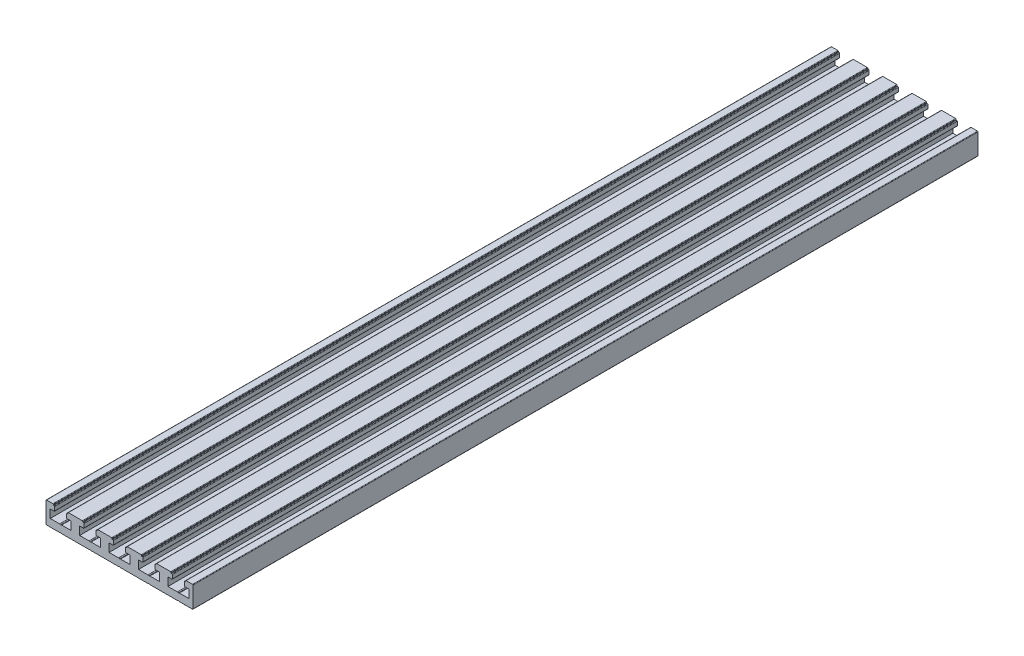
from build123d import *

# Parameters (mm, degrees)
RAWPART_DEPTH                                  = 400
CSK_FOR_M3_FLAT_HEAD_MACHINE_SCREW1_AT_2_COUNT = 2
CSK_FOR_M3_FLAT_HEAD_MACHINE_SCREW1_AT_2_PITCH = 60
CSK_FOR_M3_FLAT_HEAD_MACHINE_SCREW1_AT_3_COUNT = 2
CSK_FOR_M3_FLAT_HEAD_MACHINE_SCREW1_AT_3_PITCH = 271.707515505
CSK_FOR_M3_FLAT_HEAD_MACHINE_SCREW1_AT_4_COUNT = 2
CSK_FOR_M3_FLAT_HEAD_MACHINE_SCREW1_AT_4_PITCH = 264.999950909
M4X0_7_TAPPED_HOLE1_D                          = 3.3


with BuildPart() as part:
    # Sketch1 → RawPart (new body)
    with BuildSketch(Plane(origin=(0, 0, 0), x_dir=(-1, 0, 0), z_dir=(0, 0, -1))):
        with BuildLine():
            Line((-37.45, 8.85), (-37.45, -1.65))
            ThreePointArc((-37.45, -1.65), (-37.376776695, -1.826776695), (-37.2, -1.9))
            Line((-37.2, -1.9), (-30.543629459, -1.9))
            ThreePointArc((-30.543629459, -1.9), (-30.500649598, -1.896277753), (-30.458949592, -1.885221853))
            Line((-30.458949592, -1.885221853), (-30, -1.72))
            Line((-30, -1.72), (-29.541050408, -1.885221853))
            ThreePointArc((-29.541050408, -1.885221853), (-29.499350402, -1.896277753), (-29.456370541, -1.9))
            Line((-29.456370541, -1.9), (-15.543629459, -1.9))
            ThreePointArc((-15.543629459, -1.9), (-15.500649598, -1.896277753), (-15.458949592, -1.885221853))
            Line((-15.458949592, -1.885221853), (-15, -1.72))
            Line((-15, -1.72), (-14.541050408, -1.885221853))
            ThreePointArc((-14.541050408, -1.885221853), (-14.499350402, -1.896277753), (-14.456370541, -1.9))
            Line((-14.456370541, -1.9), (-0.543629459, -1.9))
            ThreePointArc((-0.543629459, -1.9), (-0.500649598, -1.896277753), (-0.458949592, -1.885221853))
            Line((-0.458949592, -1.885221853), (0, -1.72))
            Line((0, -1.72), (0.458949592, -1.885221853))
            ThreePointArc((0.458949592, -1.885221853), (0.500649598, -1.896277753), (0.543629459, -1.9))
            Line((0.543629459, -1.9), (14.456370541, -1.9))
            ThreePointArc((14.456370541, -1.9), (14.499350402, -1.896277753), (14.541050408, -1.885221853))
            Line((14.541050408, -1.885221853), (15, -1.72))
            Line((15, -1.72), (15.458949592, -1.885221853))
            ThreePointArc((15.458949592, -1.885221853), (15.500649598, -1.896277753), (15.543629459, -1.9))
            Line((15.543629459, -1.9), (29.456370541, -1.9))
            ThreePointArc((29.456370541, -1.9), (29.499350402, -1.896277753), (29.541050408, -1.885221853))
            Line((29.541050408, -1.885221853), (30, -1.72))
            Line((30, -1.72), (30.458949592, -1.885221853))
            ThreePointArc((30.458949592, -1.885221853), (30.500649598, -1.896277753), (30.543629459, -1.9))
            Line((30.543629459, -1.9), (37.2, -1.9))
            ThreePointArc((37.2, -1.9), (37.376776695, -1.826776695), (37.45, -1.65))
            Line((37.45, -1.65), (37.45, 8.85))
            ThreePointArc((37.45, 8.85), (37.376776695, 9.026776695), (37.2, 9.1))
            Line((37.2, 9.1), (33.95, 9.1))
            ThreePointArc((33.95, 9.1), (33.773223305, 9.026776695), (33.7, 8.85))
            Line((33.7, 8.85), (33.7, 8.5))
            Line((33.7, 8.5), (33.32, 8.5))
            ThreePointArc((33.32, 8.5), (33.143223305, 8.426776695), (33.07, 8.25))
            Line((33.07, 8.25), (33.07, 6.35))
            ThreePointArc((33.07, 6.35), (33.143223305, 6.173223305), (33.32, 6.1))
            Line((33.32, 6.1), (35.3, 6.1))
            Line((35.3, 6.1), (35.3, 1.9))
            Line((35.3, 1.9), (30.543629459, 1.9))
            ThreePointArc((30.543629459, 1.9), (30.500649598, 1.896277753), (30.458949592, 1.885221853))
            Line((30.458949592, 1.885221853), (30, 1.72))
            Line((30, 1.72), (29.541050408, 1.885221853))
            ThreePointArc((29.541050408, 1.885221853), (29.499350402, 1.896277753), (29.456370541, 1.9))
            Line((29.456370541, 1.9), (24.7, 1.9))
            Line((24.7, 1.9), (24.7, 6.1))
            Line((24.7, 6.1), (26.68, 6.1))
            ThreePointArc((26.68, 6.1), (26.856776695, 6.173223305), (26.93, 6.35))
            Line((26.93, 6.35), (26.93, 8.25))
            ThreePointArc((26.93, 8.25), (26.856776695, 8.426776695), (26.68, 8.5))
            Line((26.68, 8.5), (26.3, 8.5))
            Line((26.3, 8.5), (26.3, 8.85))
            ThreePointArc((26.3, 8.85), (26.226776695, 9.026776695), (26.05, 9.1))
            Line((26.05, 9.1), (18.95, 9.1))
            ThreePointArc((18.95, 9.1), (18.773223305, 9.026776695), (18.7, 8.85))
            Line((18.7, 8.85), (18.7, 8.5))
            Line((18.7, 8.5), (18.32, 8.5))
            ThreePointArc((18.32, 8.5), (18.143223305, 8.426776695), (18.07, 8.25))
            Line((18.07, 8.25), (18.07, 6.35))
            ThreePointArc((18.07, 6.35), (18.143223305, 6.173223305), (18.32, 6.1))
            Line((18.32, 6.1), (20.3, 6.1))
            Line((20.3, 6.1), (20.3, 1.9))
            Line((20.3, 1.9), (15.543629459, 1.9))
            ThreePointArc((15.543629459, 1.9), (15.500649598, 1.896277753), (15.458949592, 1.885221853))
            Line((15.458949592, 1.885221853), (15, 1.72))
            Line((15, 1.72), (14.541050408, 1.885221853))
            ThreePointArc((14.541050408, 1.885221853), (14.499350402, 1.896277753), (14.456370541, 1.9))
            Line((14.456370541, 1.9), (9.7, 1.9))
            Line((9.7, 1.9), (9.7, 6.1))
            Line((9.7, 6.1), (11.68, 6.1))
            ThreePointArc((11.68, 6.1), (11.856776695, 6.173223305), (11.93, 6.35))
            Line((11.93, 6.35), (11.93, 8.25))
            ThreePointArc((11.93, 8.25), (11.856776695, 8.426776695), (11.68, 8.5))
            Line((11.68, 8.5), (11.3, 8.5))
            Line((11.3, 8.5), (11.3, 8.85))
            ThreePointArc((11.3, 8.85), (11.226776695, 9.026776695), (11.05, 9.1))
            Line((11.05, 9.1), (3.95, 9.1))
            ThreePointArc((3.95, 9.1), (3.773223305, 9.026776695), (3.7, 8.85))
            Line((3.7, 8.85), (3.7, 8.5))
            Line((3.7, 8.5), (3.32, 8.5))
            ThreePointArc((3.32, 8.5), (3.143223305, 8.426776695), (3.07, 8.25))
            Line((3.07, 8.25), (3.07, 6.35))
            ThreePointArc((3.07, 6.35), (3.143223305, 6.173223305), (3.32, 6.1))
            Line((3.32, 6.1), (5.3, 6.1))
            Line((5.3, 6.1), (5.3, 1.9))
            Line((5.3, 1.9), (0.543629459, 1.9))
            ThreePointArc((0.543629459, 1.9), (0.500649598, 1.896277753), (0.458949592, 1.885221853))
            Line((0.458949592, 1.885221853), (0, 1.72))
            Line((0, 1.72), (-0.458949592, 1.885221853))
            ThreePointArc((-0.458949592, 1.885221853), (-0.500649598, 1.896277753), (-0.543629459, 1.9))
            Line((-0.543629459, 1.9), (-5.3, 1.9))
            Line((-5.3, 1.9), (-5.3, 6.1))
            Line((-5.3, 6.1), (-3.32, 6.1))
            ThreePointArc((-3.32, 6.1), (-3.143223305, 6.173223305), (-3.07, 6.35))
            Line((-3.07, 6.35), (-3.07, 8.25))
            ThreePointArc((-3.07, 8.25), (-3.143223305, 8.426776695), (-3.32, 8.5))
            Line((-3.32, 8.5), (-3.7, 8.5))
            Line((-3.7, 8.5), (-3.7, 8.85))
            ThreePointArc((-3.7, 8.85), (-3.773223305, 9.026776695), (-3.95, 9.1))
            Line((-3.95, 9.1), (-11.05, 9.1))
            ThreePointArc((-11.05, 9.1), (-11.226776695, 9.026776695), (-11.3, 8.85))
            Line((-11.3, 8.85), (-11.3, 8.5))
            Line((-11.3, 8.5), (-11.68, 8.5))
            ThreePointArc((-11.68, 8.5), (-11.856776695, 8.426776695), (-11.93, 8.25))
            Line((-11.93, 8.25), (-11.93, 6.35))
            ThreePointArc((-11.93, 6.35), (-11.856776695, 6.173223305), (-11.68, 6.1))
            Line((-11.68, 6.1), (-9.7, 6.1))
            Line((-9.7, 6.1), (-9.7, 1.9))
            Line((-9.7, 1.9), (-14.456370541, 1.9))
            ThreePointArc((-14.456370541, 1.9), (-14.499350402, 1.896277753), (-14.541050408, 1.885221853))
            Line((-14.541050408, 1.885221853), (-15, 1.72))
            Line((-15, 1.72), (-15.458949592, 1.885221853))
            ThreePointArc((-15.458949592, 1.885221853), (-15.500649598, 1.896277753), (-15.543629459, 1.9))
            Line((-15.543629459, 1.9), (-20.3, 1.9))
            Line((-20.3, 1.9), (-20.3, 6.1))
            Line((-20.3, 6.1), (-18.32, 6.1))
            ThreePointArc((-18.32, 6.1), (-18.143223305, 6.173223305), (-18.07, 6.35))
            Line((-18.07, 6.35), (-18.07, 8.25))
            ThreePointArc((-18.07, 8.25), (-18.143223305, 8.426776695), (-18.32, 8.5))
            Line((-18.32, 8.5), (-18.7, 8.5))
            Line((-18.7, 8.5), (-18.7, 8.85))
            ThreePointArc((-18.7, 8.85), (-18.773223305, 9.026776695), (-18.95, 9.1))
            Line((-18.95, 9.1), (-26.05, 9.1))
            ThreePointArc((-26.05, 9.1), (-26.226776695, 9.026776695), (-26.3, 8.85))
            Line((-26.3, 8.85), (-26.3, 8.5))
            Line((-26.3, 8.5), (-26.68, 8.5))
            ThreePointArc((-26.68, 8.5), (-26.856776695, 8.426776695), (-26.93, 8.25))
            Line((-26.93, 8.25), (-26.93, 6.35))
            ThreePointArc((-26.93, 6.35), (-26.856776695, 6.173223305), (-26.68, 6.1))
            Line((-26.68, 6.1), (-24.7, 6.1))
            Line((-24.7, 6.1), (-24.7, 1.9))
            Line((-24.7, 1.9), (-29.456370541, 1.9))
            ThreePointArc((-29.456370541, 1.9), (-29.499350402, 1.896277753), (-29.541050408, 1.885221853))
            Line((-29.541050408, 1.885221853), (-30, 1.72))
            Line((-30, 1.72), (-30.458949592, 1.885221853))
            ThreePointArc((-30.458949592, 1.885221853), (-30.500649598, 1.896277753), (-30.543629459, 1.9))
            Line((-30.543629459, 1.9), (-35.3, 1.9))
            Line((-35.3, 1.9), (-35.3, 6.1))
            Line((-35.3, 6.1), (-33.32, 6.1))
            ThreePointArc((-33.32, 6.1), (-33.143223305, 6.173223305), (-33.07, 6.35))
            Line((-33.07, 6.35), (-33.07, 8.25))
            ThreePointArc((-33.07, 8.25), (-33.143223305, 8.426776695), (-33.32, 8.5))
            Line((-33.32, 8.5), (-33.7, 8.5))
            Line((-33.7, 8.5), (-33.7, 8.85))
            ThreePointArc((-33.7, 8.85), (-33.773223305, 9.026776695), (-33.95, 9.1))
            Line((-33.95, 9.1), (-37.2, 9.1))
            ThreePointArc((-37.2, 9.1), (-37.376776695, 9.026776695), (-37.45, 8.85))
        make_face()
    extrude(amount=-RAWPART_DEPTH)

    # Sketch2 → CSK for M3 Flat Head Machine Screw1 (revolve, cut)
    with BuildSketch(Plane(origin=(-30, 1.9, 65), x_dir=(0, 0, 1), z_dir=(1, 0, 0))):
        Polygon((0, 0), (0, 3.8), (1.6, 3.8), (1.6, 1.9), (3, 0.5), (3, 0), align=None)
    csk_for_m3_flat_head_machine_screw1 = revolve(axis=Axis((-30, 8.25, 65), (0, -1, 0)), mode=Mode.SUBTRACT)

    # CSK for M3 Flat Head Machine Screw1 at 2: CSK for M3 Flat Head Machine Screw1 ×2
    with Locations(*[(i * CSK_FOR_M3_FLAT_HEAD_MACHINE_SCREW1_AT_2_PITCH, 0, 0) for i in range(1, CSK_FOR_M3_FLAT_HEAD_MACHINE_SCREW1_AT_2_COUNT)]):
        add(csk_for_m3_flat_head_machine_screw1, mode=Mode.SUBTRACT)

    # CSK for M3 Flat Head Machine Screw1 at 3: CSK for M3 Flat Head Machine Screw1 ×2
    with Locations(*[Vector(0.22082569151065257, 0, 0.9753132901631364) * (i * CSK_FOR_M3_FLAT_HEAD_MACHINE_SCREW1_AT_3_PITCH) for i in range(1, CSK_FOR_M3_FLAT_HEAD_MACHINE_SCREW1_AT_3_COUNT)]):
        add(csk_for_m3_flat_head_machine_screw1, mode=Mode.SUBTRACT)

    # CSK for M3 Flat Head Machine Screw1 at 4: CSK for M3 Flat Head Machine Screw1 ×2
    with Locations(*[(0, 0, i * CSK_FOR_M3_FLAT_HEAD_MACHINE_SCREW1_AT_4_PITCH) for i in range(1, CSK_FOR_M3_FLAT_HEAD_MACHINE_SCREW1_AT_4_COUNT)]):
        add(csk_for_m3_flat_head_machine_screw1, mode=Mode.SUBTRACT)

    # M4x0.7 Tapped Hole1 (through all)
    with Locations(Plane(origin=(0, 1.9, 0), x_dir=(1, 0, 0), z_dir=(0, 1, 0))):
        with Locations((15, -30), (15, -372)):
            Hole(M4X0_7_TAPPED_HOLE1_D / 2)


solid = part.part
